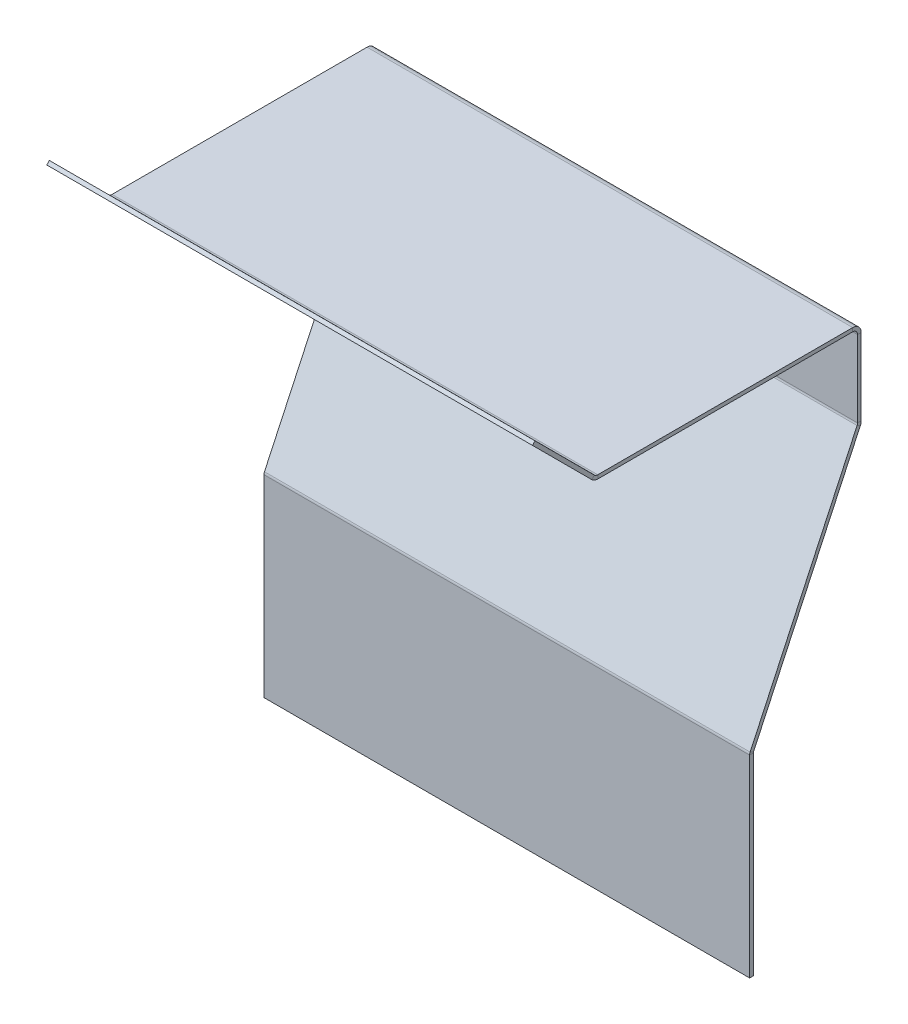
from build123d import *

# Parameters (mm, degrees)
SKETCH1_W          = 200
SKETCH1_H          = 105
BASE_FLANGE1_DEPTH = 1.524
EDGE_FLANGE1_DEPTH = 200
EDGE_FLANGE2_DEPTH = 200
EDGE_FLANGE3_DEPTH = 200
EDGE_FLANGE4_DEPTH = 200


# Sheet-metal steps are written as plain solids
with BuildPart() as part:
    # Sketch1 → Base-Flange1 (new body)
    with BuildSketch(Plane(origin=(0, 0, 0), x_dir=(1, 0, 0), z_dir=(0, 1, 0))):
        Rectangle(SKETCH1_W, SKETCH1_H)
    extrude(amount=-BASE_FLANGE1_DEPTH)

    # Edge-Flange1 section (across the edge) → Edge-Flange1 (add)
    with BuildSketch(Plane(origin=(-100, 0, 53.32063991), x_dir=(0, 0.7071067811865512, -0.7071067811865438), z_dir=(1, 0, 0))):
        with BuildLine():
            Line((-1.524, 0.82063991), (-1.524, 35.368738531))
            Line((-1.524, 35.368738531), (0, 35.368738531))
            Line((0, 35.368738531), (0, 0.82063991))
            ThreePointArc((0, 0.82063991), (0.15080987, 0.062467494), (0.580280045, -0.580280045))
            Line((0.580280045, -0.580280045), (-0.497350689, -1.65791078))
            ThreePointArc((-0.497350689, -1.65791078), (-1.257182537, -0.520742057), (-1.524, 0.82063991))
        make_face()
    extrude(amount=EDGE_FLANGE1_DEPTH)

    # Edge-Flange2 section (across the edge) → Edge-Flange2 (add)
    with BuildSketch(Plane(origin=(-100, -1.524, -54.4812), x_dir=(0, 0, 1), z_dir=(1, 0, 0))):
        with BuildLine():
            Line((-1.524, 1.9812), (-1.524, 33.476))
            Line((-1.524, 33.476), (0, 33.476))
            Line((0, 33.476), (0, 1.9812))
            ThreePointArc((0, 1.9812), (0.580280045, 0.580280045), (1.9812, 0))
            Line((1.9812, 0), (1.9812, -1.524))
            ThreePointArc((1.9812, -1.524), (-0.497350689, -0.497350689), (-1.524, 1.9812))
        make_face()
    extrude(amount=EDGE_FLANGE2_DEPTH)

    # Edge-Flange3 section (across the edge) → Edge-Flange3 (add)
    with BuildSketch(Plane(origin=(-100, -35.439221466, -54.4812), x_dir=(0, 0.4226182617406906, 0.906307787036654), z_dir=(1, 0, 0))):
        with BuildLine():
            Line((-1.524, 0.439221466), (-1.524, 104.662137334))
            Line((-1.524, 104.662137334), (0, 104.662137334))
            Line((0, 104.662137334), (0, 0.439221466))
            ThreePointArc((0, 0.439221466), (0.046962351, 0.010411302), (0.185623012, -0.398069835))
            Line((0.185623012, -0.398069835), (-1.195590055, -1.042140065))
            ThreePointArc((-1.195590055, -1.042140065), (-1.440912764, -0.319442669), (-1.524, 0.439221466))
        make_face()
    extrude(amount=EDGE_FLANGE3_DEPTH)

    # Edge-Flange4 section (across the edge) → Edge-Flange4 (add)
    with BuildSketch(Plane(origin=(100, -131.087402093, -11.561268833), x_dir=(0, 0, -1), z_dir=(-1, 0, 0))):
        with BuildLine():
            Line((-1.524, 0.163300289), (-1.524, 79.662137334))
            Line((-1.524, 79.662137334), (0, 79.662137334))
            Line((0, 79.662137334), (0, 0.163300289))
            ThreePointArc((0, 0.163300289), (0.017460361, 0.003870869), (0.069013684, -0.148000323))
            Line((0.069013684, -0.148000323), (-1.312199383, -0.792070554))
            ThreePointArc((-1.312199383, -0.792070554), (-1.470414754, -0.325983103), (-1.524, 0.163300289))
        make_face()
    extrude(amount=EDGE_FLANGE4_DEPTH)


solid = part.part
